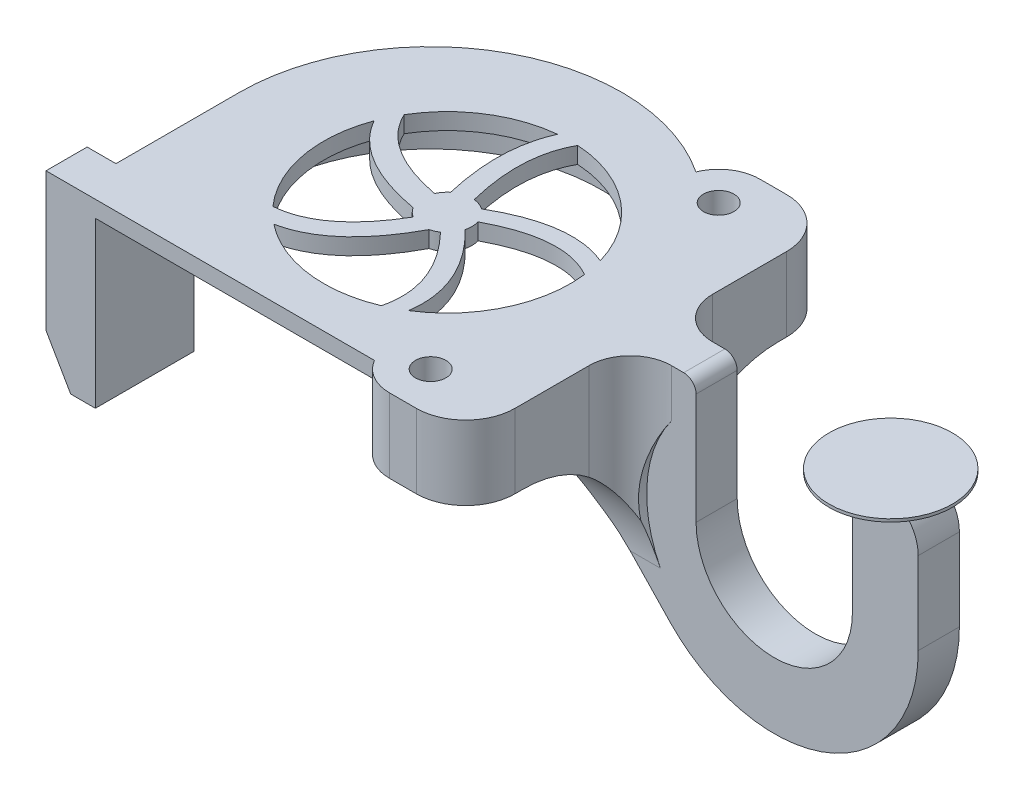
from build123d import *

# Parameters (mm, degrees)
SKETCH1_R           = 1.85
BOSS_EXTRUDE1_DEPTH = 9
BOSS_EXTRUDE4_DEPTH = 2.5
FILLET5_R           = 5
SKETCH9_R           = 15
BOSS_EXTRUDE5_DEPTH = 2
BOSS_EXTRUDE6_DEPTH = 2
FILLET6_R           = 1.5
FILLET9_R           = 13
FILLET10_R          = 5
SKETCH7_R           = 15.5
CUT_EXTRUDE4_DEPTH  = 5
CUT_EXTRUDE5_START  = 5
SKETCH8_R           = 15.5
CUT_EXTRUDE5_DEPTH  = 5
FILLET11_R          = 10
FILLET12_R          = 6
BOSS_EXTRUDE7_DEPTH = 22
CHAMFER1_SIZE       = 3
CHAMFER1_SIZE2      = 5.196152423
SKETCH17_R          = 7.5
BOSS_EXTRUDE8_DEPTH = 0.35


with BuildPart() as part:
    # Sketch1 → Boss-Extrude1 (new body)
    with BuildSketch(Plane(origin=(0, 0, 0), x_dir=(1, 0, 0), z_dir=(0, 1, 0))):
        with BuildLine():
            Line((-20.75, 0), (-20.75, -20))
            Line((-20.75, -20), (-23.25, -20))
            Line((-23.25, -20), (-23.25, 0))
            ThreePointArc((-23.25, 0), (-20.489109552, 10.989034979), (-12.862138515, 19.368218628))
            ThreePointArc((-12.862138515, 19.368218628), (0, 23.25), (12.862138515, 19.368218628))
            ThreePointArc((12.862138515, 19.368218628), (14.70188395, 21.643735823), (17.5, 22.5))
            Line((17.5, 22.5), (18.75, 22.5))
            Line((18.75, 22.5), (26.75, 22.5))
            Line((26.75, 22.5), (26.75, -22.5))
            Line((26.75, -22.5), (17.5, -22.5))
            ThreePointArc((17.5, -22.5), (13.964466094, -21.035533906), (12.5, -17.5))
            Line((12.5, -17.5), (16.07387993, -13.122228621))
            ThreePointArc((16.07387993, -13.122228621), (6.965252739, 19.546041908), (-20.75, 0))
        make_face()
        with Locations(Location((17.5, 17.5, 0), (0, 0, 270))):
            Circle(SKETCH1_R, mode=Mode.SUBTRACT)
        with Locations(Location((17.5, -17.5, 0), (0, 0, 270))):
            Circle(SKETCH1_R, mode=Mode.SUBTRACT)
    extrude(amount=BOSS_EXTRUDE1_DEPTH)

    # Sketch6 → Boss-Extrude4 (add, symmetric)
    with BuildSketch(Plane.XY):
        with BuildLine():
            Line((21.25, 9), (34.75, 9))
            Line((34.75, 9), (34.75, -6))
            ThreePointArc((34.75, -6), (44.25, -15.5), (53.75, -6))
            Line((53.75, -6), (53.75, 9))
            Line((53.75, 9), (61.75, 9))
            Line((61.75, 9), (61.75, -6))
            ThreePointArc((61.75, -6), (50.758759211, -22.244569971), (31.591593881, -18.083656505))
            Line((31.591593881, -18.083656505), (21.25, -7.250172849))
            Line((21.25, -7.250172849), (21.25, 9))
        make_face()
    extrude(amount=BOSS_EXTRUDE4_DEPTH, both=True)

    # Fillet5
    fillet5_edges = [part.edges().sort_by_distance(p)[0] for p in [
        (61.75, 9, 0),
    ]]
    fillet(fillet5_edges, radius=FILLET5_R)

    # Sketch9 → Boss-Extrude5 (add)
    with BuildSketch(Plane(origin=(0, 9, 0), x_dir=(1, 0, 0), z_dir=(0, 1, 0))):
        with BuildLine():
            Line((-22, 0), (-22, -20))
            Line((-22, -20), (13.169872981, -20))
            Line((13.169872981, -20), (18.372358938, -12.101918321))
            ThreePointArc((18.372358938, -12.101918321), (6.316965386, 21.073584136), (-22, 0))
        make_face()
        with Locations(Location((2, 0, 0), (0, 0, 270))):
            Circle(SKETCH9_R, mode=Mode.SUBTRACT)
    extrude(amount=-BOSS_EXTRUDE5_DEPTH)

    # Sketch11 → Boss-Extrude6 (add)
    with BuildSketch(Plane(origin=(0, 9, 0), x_dir=(1, 0, 0), z_dir=(0, 1, 0))):
        with BuildLine():
            Line((6.478868008, 20.826670606), (7.392512522, 19.052254172))
            add(Edge.make_bspline(
                [(2.301650463, 2.984795973), (2.177037385, 3.486856685), (1.986635821, 4.336000757), (1.798388489, 5.376186433), (1.586261195, 6.793381709), (1.432378413, 8.729372962), (1.55892194, 11.063237164), (2.032292123, 13.176125623), (2.840893225, 15.01740813), (3.982479019, 16.606661709), (5.227126691, 17.738273237), (6.397392288, 18.525286398), (7.060031891, 18.887911537), (7.392512522, 19.052254172)],
                knots=[0, 0, 0, 0, 0.0625, 0.103003153, 0.134253153, 0.25, 0.375, 0.5, 0.625, 0.75, 0.875, 0.9375, 1, 1, 1, 1], degree=3))
            ThreePointArc((2.301650463, 2.984795973), (3.048806578, 2.810694712), (3.727376161, 2.452788535))
            add(Edge.make_bspline(
                [(3.727376161, 2.452788535), (3.836836719, 2.516333628), (4.777230752, 3.053662544), (6.558715436, 3.92769731), (9.007954532, 4.74361513), (11.41706583, 5.121367246), (13.73698029, 5.032963977), (15.94913121, 4.472022332), (17.687795689, 3.612574943), (19.00292323, 2.703924829), (19.647271259, 2.16617517), (19.953849575, 1.887899226)],
                knots=[0.115512242, 0.115512242, 0.115512242, 0.115512242, 0.131137242, 0.25, 0.375, 0.5, 0.625, 0.75, 0.875, 0.9375, 1, 1, 1, 1], degree=3))
            Line((19.953849575, 1.887899226), (19.256436867, 0.017895083))
            add(Edge.make_bspline(
                [(4.872159822, 0.866428276), (4.977312157, 0.922929722), (5.858605577, 1.388664221), (7.527178178, 2.141468884), (9.766648332, 2.810579345), (11.91526086, 3.078611385), (13.921444211, 2.939380007), (15.802866492, 2.401611227), (17.288343775, 1.612276241), (18.424349244, 0.776571234), (18.989461511, 0.275336398), (19.256436867, 0.017895083)],
                knots=[0.118628153, 0.118628153, 0.118628153, 0.118628153, 0.134253153, 0.25, 0.375, 0.5, 0.625, 0.75, 0.875, 0.9375, 1, 1, 1, 1], degree=3))
            ThreePointArc((4.872159822, 0.866428276), (4.999042276, 0.075798597), (4.912261479, -0.720231265))
            add(Edge.make_bspline(
                [(4.912261479, -0.720231265), (5.002998254, -0.808472018), (5.774254717, -1.568884255), (7.096784972, -3.048255125), (8.543630825, -5.186275499), (9.557747432, -7.403950275), (10.09893718, -9.661588842), (10.156041609, -11.943037133), (9.797896529, -13.849168316), (9.278032858, -15.360772511), (8.934206242, -16.126371842), (8.749030506, -16.496692935)],
                knots=[0.115512242, 0.115512242, 0.115512242, 0.115512242, 0.131137242, 0.25, 0.375, 0.5, 0.625, 0.75, 0.875, 0.9375, 1, 1, 1, 1], degree=3))
            Line((8.749030506, -16.496692935), (6.754318317, -16.563200543))
            add(Edge.make_bspline(
                [(3.679512686, -2.48580714), (3.762356094, -2.571751289), (4.449156797, -3.29417188), (5.625321355, -4.696843017), (6.875370455, -6.671763934), (7.714717493, -8.667728241), (8.123455361, -10.636761093), (8.114764777, -12.593510831), (7.756766389, -14.23714389), (7.259577077, -15.556884042), (6.929927778, -16.236530697), (6.754318317, -16.563200543)],
                knots=[0.118628153, 0.118628153, 0.118628153, 0.118628153, 0.134253153, 0.25, 0.375, 0.5, 0.625, 0.75, 0.875, 0.9375, 1, 1, 1, 1], degree=3))
            ThreePointArc((3.679512686, -2.48580714), (3.215643755, -2.74266481), (2.713799431, -2.913844603))
            add(Edge.make_bspline(
                [(2.713799431, -2.913844603), (2.66122127, -3.012012371), (2.455914751, -3.390715948), (2.120708193, -3.979402349), (1.330890602, -5.277180689), (0.114294012, -6.993572468), (-1.64759812, -8.880429684), (-3.583560994, -10.363184437), (-5.663858448, -11.39380597), (-7.875228796, -11.957816966), (-9.813241319, -12.03339108), (-11.402678431, -11.863405364), (-12.225640986, -11.698809764), (-12.627912469, -11.600802525)],
                knots=[0.049558007, 0.049558007, 0.049558007, 0.049558007, 0.0625, 0.099887242, 0.131137242, 0.25, 0.375, 0.5, 0.625, 0.75, 0.875, 0.9375, 1, 1, 1, 1], degree=3))
            Line((-12.627912469, -11.600802525), (-12.893258191, -9.622699488))
            add(Edge.make_bspline(
                [(0.430430883, -2.556648742), (0.357424415, -2.681182252), (0.159245679, -3.013265483), (-0.511108157, -4.084209706), (-1.652991004, -5.655147516), (-3.26662961, -7.346036581), (-5.000091925, -8.643528534), (-6.811647866, -9.516696381), (-8.712319975, -9.981874407), (-10.393731665, -10.032344263), (-11.794570595, -9.869367043), (-12.533797015, -9.714020539), (-12.893258191, -9.622699488)],
                knots=[0.084683234, 0.084683234, 0.084683234, 0.084683234, 0.103003153, 0.134253153, 0.25, 0.375, 0.5, 0.625, 0.75, 0.875, 0.9375, 1, 1, 1, 1], degree=3))
            ThreePointArc((0.430430883, -2.556648742), (-0.117278478, -2.125354523), (-0.550654743, -1.579291102))
            add(Edge.make_bspline(
                [(-0.550654743, -1.579291102), (-0.660265383, -1.559621808), (-1.083877091, -1.481389546), (-1.747335652, -1.344503267), (-3.225663257, -0.994377662), (-5.233997865, -0.367719777), (-7.572960327, 0.724868271), (-9.581389324, 2.107881961), (-11.204415916, 3.767882841), (-12.424173267, 5.696732039), (-13.094927325, 7.516537791), (-13.424424382, 9.080710789), (-13.52219408, 9.914257527), (-13.553292381, 10.327126345)],
                knots=[0.049558007, 0.049558007, 0.049558007, 0.049558007, 0.0625, 0.099887242, 0.131137242, 0.25, 0.375, 0.5, 0.625, 0.75, 0.875, 0.9375, 1, 1, 1, 1], degree=3))
            Line((-13.553292381, 10.327126345), (-11.868581467, 11.397196023))
            add(Edge.make_bspline(
                [(-0.742653651, 1.21566893), (-0.884461109, 1.242672351), (-1.263780847, 1.317975867), (-2.497539059, 1.590255994), (-4.36049102, 2.139029199), (-6.494689195, 3.091989603), (-8.298476125, 4.289791623), (-9.728718809, 5.703496996), (-10.804502538, 7.338010511), (-11.416057089, 8.905075765), (-11.732416505, 10.279422155), (-11.834034782, 11.027928642), (-11.868581467, 11.397196023)],
                knots=[0.084683234, 0.084683234, 0.084683234, 0.084683234, 0.103003153, 0.134253153, 0.25, 0.375, 0.5, 0.625, 0.75, 0.875, 0.9375, 1, 1, 1, 1], degree=3))
            ThreePointArc((-0.742653651, 1.21566893), (-0.387494898, 1.816553911), (0.096907045, 2.319102672))
            add(Edge.make_bspline(
                [(0.096907045, 2.319102672), (-0.032531232, 2.869876034), (-0.222771722, 3.770623141), (-0.413133276, 4.893321619), (-0.633044747, 6.466672996), (-0.784659695, 8.661410477), (-0.607760191, 11.35514324), (-0.022425231, 13.837032809), (0.979075328, 16.048515121), (2.395592055, 17.969091955), (3.91422142, 19.31334001), (5.313282167, 20.228050133), (6.088375407, 20.639672405), (6.478868008, 20.826670606)],
                knots=[0, 0, 0, 0, 0.0625, 0.099887242, 0.131137242, 0.25, 0.375, 0.5, 0.625, 0.75, 0.875, 0.9375, 1, 1, 1, 1], degree=3))
        make_face()
    extrude(amount=-BOSS_EXTRUDE6_DEPTH)

    # Fillet6
    fillet6_edges = [part.edges().sort_by_distance(p)[0] for p in [
        (34.75, 9, 0),
        (53.75, 9, 0),
    ]]
    fillet(fillet6_edges, radius=FILLET6_R)

    # Fillet9
    # the kernel refuses this fillet: 13 mm, written as the material it adds along each edge
    with BuildSketch(Plane(origin=(21.25, 0, 2.5), x_dir=(0, 0, 1), z_dir=(1, 0, 0))) as fillet9_piece_1_section:
        with BuildLine():
            CenterArc((FILLET9_R, FILLET9_R), FILLET9_R, 180, 90)
            Line((0, FILLET9_R), (0, 0))
            Line((0, 0), (FILLET9_R, 0))
        make_face()
    fillet9_piece_1 = extrude(amount=5.5, mode=Mode.PRIVATE)
    fillet9_piece_1 = split(fillet9_piece_1, bisect_by=Plane(origin=(20.120845898, -6.06731142, 3.705560147), z_dir=(0.7233374924872102, 0.6904946574466128, 0)), keep=Keep.TOP, mode=Mode.PRIVATE)
    add(fillet9_piece_1)
    with BuildSketch(Plane(origin=(21.25, 0, -2.5), x_dir=(0, -1, 0), z_dir=(1, 0, 0))) as fillet9_piece_2_section:
        with BuildLine():
            CenterArc((FILLET9_R, FILLET9_R), FILLET9_R, 180, 90)
            Line((0, FILLET9_R), (0, 0))
            Line((0, 0), (FILLET9_R, 0))
        make_face()
    fillet9_piece_2 = extrude(amount=5.5, mode=Mode.PRIVATE)
    fillet9_piece_2 = split(fillet9_piece_2, bisect_by=Plane(origin=(20.346398639, -6.3035924, -5.449752189), z_dir=(0.7233374924872102, 0.6904946574466128, 0)), keep=Keep.TOP, mode=Mode.PRIVATE)
    add(fillet9_piece_2)

    # Fillet10
    fillet10_edges = [part.edges().sort_by_distance(p)[0] for p in [
        (26.75, -2, -2.5),
        (26.75, -2, 2.5),
    ]]
    fillet(fillet10_edges, radius=FILLET10_R)

    # Sketch7 → Cut-Extrude4 (cut)
    with BuildSketch(Plane(origin=(0, 0, -2.5), x_dir=(-1, 0, 0), z_dir=(0, 0, -1))):
        with Locations((-44.25, -6)):
            Circle(SKETCH7_R)
    extrude(amount=CUT_EXTRUDE4_DEPTH, mode=Mode.SUBTRACT)

    # Sketch8 → Cut-Extrude5 (cut)
    with BuildSketch(Plane.XY.offset(2.5).offset(CUT_EXTRUDE5_START)):
        with Locations((44.25, -6)):
            Circle(SKETCH8_R)
    extrude(amount=-CUT_EXTRUDE5_DEPTH, mode=Mode.SUBTRACT)

    # Fillet11
    fillet11_edges = [part.edges().sort_by_distance(p)[0] for p in [
        (21.25, -7.250172849, 0),
    ]]
    fillet(fillet11_edges, radius=FILLET11_R)

    # Fillet12
    fillet12_edges = [part.edges().sort_by_distance(p)[0] for p in [
        (26.75, 4.5, -22.5),
        (26.75, 4.5, 22.5),
    ]]
    fillet(fillet12_edges, radius=FILLET12_R)

    # Sketch16 → Boss-Extrude7 (add)
    with BuildSketch(Plane(origin=(0, 9, 0), x_dir=(1, 0, 0), z_dir=(0, 1, 0))):
        Polygon((-23.25, -8), (-23.25, -15), (-26.75, -15), (-26.75, -20), (-20.75, -20), (-20.75, -8), align=None)
    extrude(amount=-BOSS_EXTRUDE7_DEPTH)

    # Chamfer1
    chamfer1_edges = [part.edges().sort_by_distance(p)[0] for p in [
        (-26.75, -13, 17.5),
    ]]
    chamfer1_side = [part.faces().sort_by_distance(p)[0] for p in [
        (-23.105263158, -13, 15.289473684),
    ]]
    chamfer(chamfer1_edges, length=CHAMFER1_SIZE, length2=CHAMFER1_SIZE2, reference=chamfer1_side[0])

    # Sketch17 → Boss-Extrude8 (add)
    with BuildSketch(Plane(origin=(0, 9, 0), x_dir=(1, 0, 0), z_dir=(0, 1, 0))):
        with Locations(Location((55.906880132, 0, 0), (0, 0, 270))):
            Circle(SKETCH17_R)
    extrude(amount=-BOSS_EXTRUDE8_DEPTH)


solid = part.part
